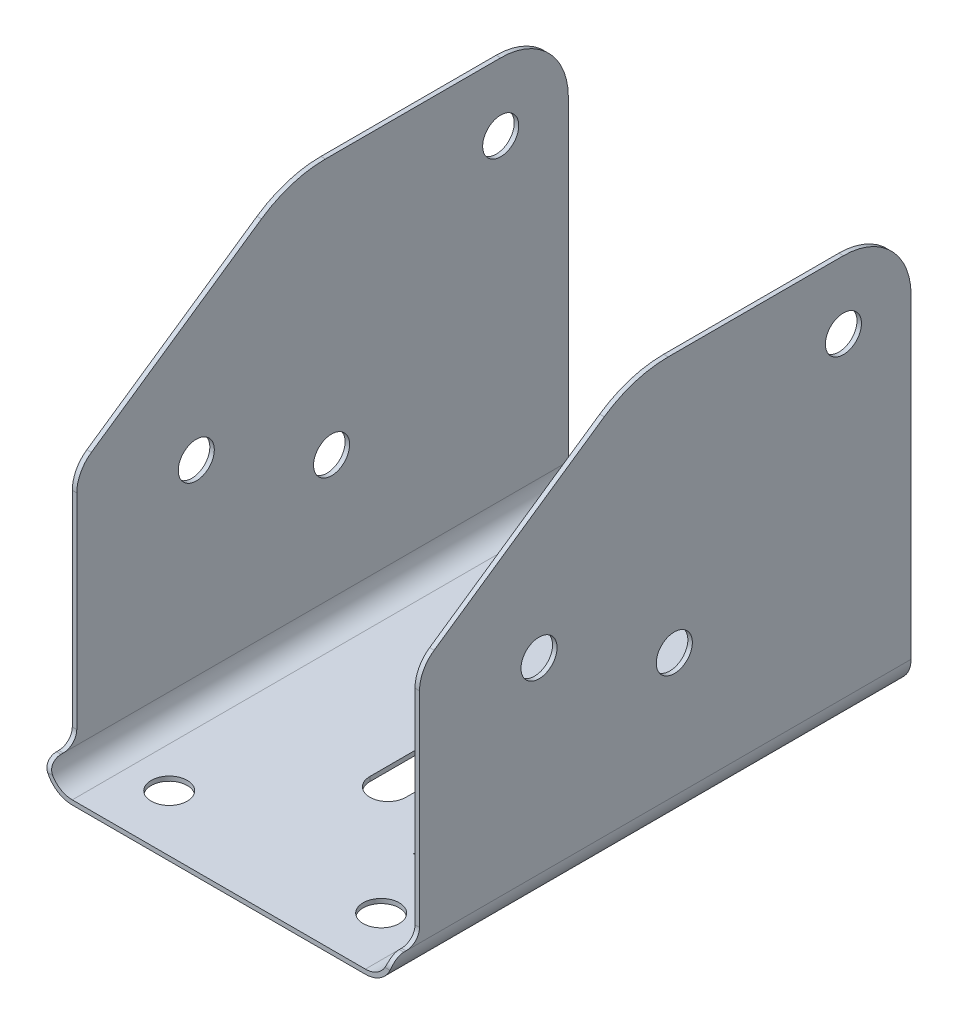
from build123d import *

# Parameters (mm, degrees)
SKETCH1_W                      = 150
SKETCH1_H                      = 230
BASE_FLANGE1_DEPTH             = 2
EDGE_FLANGE1_STRIP_W           = 28
EDGE_FLANGE1_STRIP_H           = 2
EDGE_FLANGE1_STRIP_CUT_DEPTH   = 230
EDGE_FLANGE1_STRIP_2_W         = 28
EDGE_FLANGE1_STRIP_2_H         = 2
EDGE_FLANGE1_STRIP_CUT_2_DEPTH = 230
EDGE_FLANGE1_DEPTH             = 230
EDGE_FLANGE1_BEND_DEPTH        = 230
SKETCH15_OUTSIDE_W             = 298.254
SKETCH15_OUTSIDE_H             = 250.254
SKETCH15_OUTSIDE_R             = 8
CUT_EXTRUDE1_DEPTH             = 264.326793168
SKETCH16_R                     = 8
CUT_EXTRUDE2_DEPTH             = 228.055059487
CUT_EXTRUDE3_DEPTH             = 228.055059487
SKETCHED_START                 = 47
SKETCHED_BEND1_DEPTH           = 11.052994728
SKETCHED_BEND1_2_DEPTH         = 11.052994728
CUT_EXTRUDE4_REACH             = 241.866
SKETCH20_R                     = 1.25


# Read off the part's stored shape, not the designer's step: Sketched Bend1
# Sheet-metal steps are written as plain solids
with BuildPart() as part:
    # Sketch1 → Base-Flange1 (new body)
    with BuildSketch(Plane(origin=(0, 0, 0), x_dir=(1, 0, 0), z_dir=(0, 1, 0))):
        Rectangle(SKETCH1_W, SKETCH1_H)
    extrude(amount=-BASE_FLANGE1_DEPTH)

    # Edge-Flange1 strip (across the edge) → Edge-Flange1 strip cut (cut)
    with BuildSketch(Plane(origin=(75, 0, 115), x_dir=(-1, 0, 0), z_dir=(0, 0, -1))):
        with Locations((-4, -1)):
            Rectangle(EDGE_FLANGE1_STRIP_W, EDGE_FLANGE1_STRIP_H)
    extrude(amount=EDGE_FLANGE1_STRIP_CUT_DEPTH, mode=Mode.SUBTRACT)

    # Edge-Flange1 strip 2 (across the edge) → Edge-Flange1 strip cut 2 (cut)
    with BuildSketch(Plane(origin=(-75, 0, -115), x_dir=(1, 0, 0), z_dir=(0, 0, 1))):
        with Locations((-4, -1)):
            Rectangle(EDGE_FLANGE1_STRIP_2_W, EDGE_FLANGE1_STRIP_2_H)
    extrude(amount=EDGE_FLANGE1_STRIP_CUT_2_DEPTH, mode=Mode.SUBTRACT)

    # Edge-Flange1 section (across the edge) → Edge-Flange1 (add)
    with BuildSketch(Plane(origin=(75, 0, 115), x_dir=(-1, 0, 0), z_dir=(0, 0, -1))):
        with BuildLine():
            Line((-2, 10), (-2, 180))
            Line((-2, 180), (0, 180))
            Line((0, 180), (0, 10))
            ThreePointArc((0, 10), (2.928932188, 2.928932188), (10, 0))
            Line((10, 0), (10, -2))
            ThreePointArc((10, -2), (1.514718626, 1.514718626), (-2, 10))
        make_face()
    extrude(amount=EDGE_FLANGE1_DEPTH)

    # Edge-Flange1 section 2 (across the edge) → Edge-Flange1 bend (add)
    with BuildSketch(Plane(origin=(-75, 0, -115), x_dir=(1, 0, 0), z_dir=(0, 0, 1))):
        with BuildLine():
            Line((-2, 10), (-2, 180))
            Line((-2, 180), (0, 180))
            Line((0, 180), (0, 10))
            ThreePointArc((0, 10), (2.928932188, 2.928932188), (10, 0))
            Line((10, 0), (10, -2))
            ThreePointArc((10, -2), (1.514718626, 1.514718626), (-2, 10))
        make_face()
    extrude(amount=EDGE_FLANGE1_BEND_DEPTH)

    # Sketch15 outside → Cut-Extrude1 (cut, through all)
    # profile 1 of 4: a face of its own
    with BuildSketch(Plane.ZY.offset(77)):
        with Locations((0, 89)):
            Rectangle(SKETCH15_OUTSIDE_W, SKETCH15_OUTSIDE_H)
        with BuildLine():
            Line((21.083470393, 171.180744276), (96.507242037, 119.243178795))
            ThreePointArc((96.507242037, 119.243178795), (101.277963521, 113.867184852), (103, 106.888955512))
            Line((103, 106.888955512), (103, 16))
            ThreePointArc((103, 16), (104.757359313, 11.757359313), (109, 10))
            Line((109, 10), (110, 10))
            ThreePointArc((110, 10), (113.535533906, 8.535533906), (115, 5))
            Line((115, 5), (115, -2))
            Line((115, -2), (-115, -2))
            Line((-115, -2), (-115, 99))
            Line((-115, 99), (-115, 150))
            ThreePointArc((-115, 150), (-106.213203436, 171.213203436), (-85, 180))
            Line((-85, 180), (-49, 180))
            Line((-49, 180), (-7.274003064, 180))
            ThreePointArc((-7.274003064, 180), (7.574612801, 177.744304445), (21.083470393, 171.180744276))
        make_face(mode=Mode.SUBTRACT)
    # profile 2 of 4: a face of its own
    with BuildSketch(Plane.ZY.offset(77)):
        with Locations(Location((50, 93, 0), (0, 0, 270))):
            Circle(SKETCH15_OUTSIDE_R)
    # profile 3 of 4: a face of its own
    with BuildSketch(Plane.ZY.offset(77)):
        with Locations(Location((-85, 150, 0), (0, 0, 270))):
            Circle(SKETCH15_OUTSIDE_R)
    # profile 4 of 4: a face of its own
    with BuildSketch(Plane.ZY.offset(77)):
        with Locations(Location((-10, 65, 0), (0, 0, 270))):
            Circle(SKETCH15_OUTSIDE_R)
    extrude(amount=-CUT_EXTRUDE1_DEPTH, mode=Mode.SUBTRACT)

    # Sketch16 → Cut-Extrude2 (cut, through all)
    with BuildSketch(Plane(origin=(0, 0, 0), x_dir=(1, 0, 0), z_dir=(0, 1, 0))):
        with Locations(Location((-47, 90, 0), (0, 0, 270))):
            Circle(SKETCH16_R)
        with Locations(Location((47, 90, 0), (0, 0, 90))):
            Circle(SKETCH16_R)
        with Locations(Location((47, -90, 0), (0, 0, 270))):
            Circle(SKETCH16_R)
        with Locations(Location((-47, -90, 0), (0, 0, 90))):
            Circle(SKETCH16_R)
        with BuildLine():
            Line((8, 40), (8, -40))
            ThreePointArc((8, -40), (0, -48), (-8, -40))
            Line((-8, -40), (-8, 40))
            ThreePointArc((-8, 40), (0, 48), (8, 40))
        make_face()
    extrude(amount=-CUT_EXTRUDE2_DEPTH, mode=Mode.SUBTRACT)

    # Sketch18 → Cut-Extrude3 (cut, through all)
    with BuildSketch(Plane(origin=(0, 0, 0), x_dir=(1, 0, 0), z_dir=(0, 1, 0))):
        Polygon((31.4, -45), (44.4, -45), (44.4, -60.052994728), (31.4, -60.052994728), (31.4, -58.052994728), (42.4, -58.052994728), (42.4, -47), (31.4, -47), align=None)
    extrude(amount=-CUT_EXTRUDE3_DEPTH, mode=Mode.SUBTRACT)

    # Sketched Bend1 outline → Sketched Bend1 (cut)
    with BuildSketch(Plane.XY.offset(SKETCHED_START)):
        with BuildLine():
            ThreePointArc((34.035602398, 0), (33.054267209, -1.443395312), (31.4, -2))
            Line((31.4, -2), (42.4, -2))
            Line((42.4, -2), (42.4, 0))
            Line((42.4, 0), (34.035602398, 0))
        make_face()
    extrude(amount=SKETCHED_BEND1_DEPTH, mode=Mode.SUBTRACT)

    # Sketched Bend1 2 outline → Sketched Bend1 2 (add)
    with BuildSketch(Plane.XY.offset(SKETCHED_START)):
        with BuildLine():
            Line((31.4, 0), (34.035602398, 0))
            ThreePointArc((34.035602398, 0), (34.111233029, 0.364854094), (34.1366, 0.7366))
            Line((34.1366, 0.7366), (34.1366, 9.008755099))
            Line((34.1366, 9.008755099), (32.1366, 9.008755099))
            Line((32.1366, 9.008755099), (32.1366, 0.7366))
            ThreePointArc((32.1366, 0.7366), (31.920854855, 0.215745145), (31.4, 0))
        make_face()
    extrude(amount=SKETCHED_BEND1_2_DEPTH)

    # Sketch20 → Cut-Extrude4 (cut, up to next)
    with BuildSketch(Plane.ZY.offset(-32.1366), mode=Mode.PRIVATE) as cut_extrude4_sk1:
        with Locations(Location((52.526497364, 4.9366, 0), (0, 0, 270))):
            Circle(SKETCH20_R)
    cut_extrude4_tool1 = extrude(cut_extrude4_sk1.sketch, amount=-CUT_EXTRUDE4_REACH, mode=Mode.PRIVATE) & part.part
    add(cut_extrude4_tool1.solids().sort_by_distance((32.1366, 4.9366, 52.526497))[0], mode=Mode.SUBTRACT)


solid = part.part
